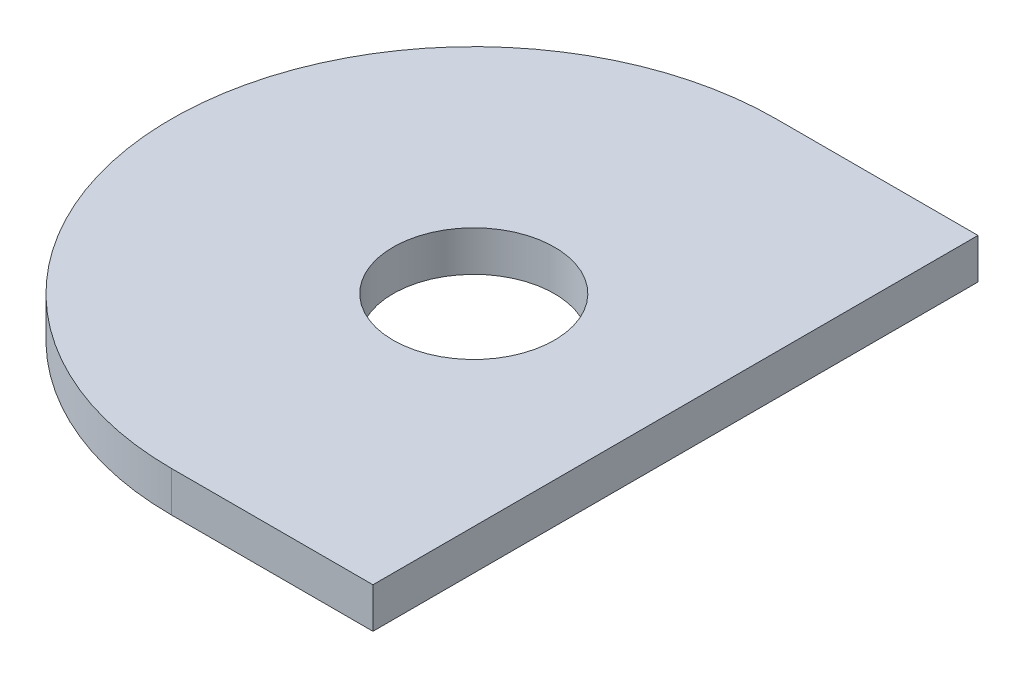
from build123d import *

# Parameters (mm, degrees)
SKETCH1_R           = 8
BOSS_EXTRUDE1_DEPTH = 4


with BuildPart() as part:
    # Sketch1 → Boss-Extrude1 (new body)
    with BuildSketch(Plane(origin=(0, 0, 0), x_dir=(1, 0, 0), z_dir=(0, 1, 0))):
        with BuildLine():
            Line((0, 60), (20, 60))
            Line((20, 60), (20, 0))
            Line((20, 0), (0, 0))
            ThreePointArc((0, 0), (-30, 30), (0, 60))
        make_face()
        with Locations((0, 30)):
            Circle(SKETCH1_R, mode=Mode.SUBTRACT)
    extrude(amount=BOSS_EXTRUDE1_DEPTH)


solid = part.part
